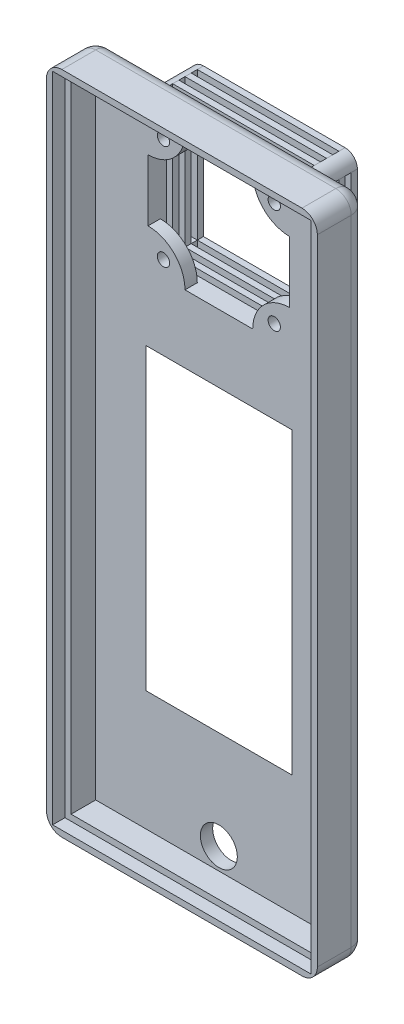
from build123d import *

# Parameters (mm, degrees)
SKICA1_W                 = 23.7
SKICA1_H                 = 48.55
SKICA1_W_2               = 23
SKICA1_H_2               = 22
P_IDAT_VYSUNUT_M1_DEPTH  = 2
SKICA3_R                 = 3
ODEBRAT_VYSUNUT_M1_DEPTH = 4
ZKOSEN_1_SIZE            = 3.464101615
ZKOSEN_1_SIZE_2          = 2
SKICA5_W                 = 44
SKICA5_H                 = 108
SKICA5_W_2               = 40
SKICA5_H_2               = 104
P_IDAT_VYSUNUT_M3_DEPTH  = 6
ZAOBLIT2_R               = 2.5
SKICA6_W                 = 27
SKICA6_H                 = 26
SKICA6_W_2               = 23
SKICA6_H_2               = 22
P_IDAT_VYSUNUT_M4_DEPTH  = 7
SKICA7_R                 = 1
P_IDAT_VYSUNUT_M5_DEPTH  = 2
SKICA8_W                 = 23
SKICA8_H                 = 1
ODEBRAT_VYSUNUT_M3_DEPTH = 30
SKICA9_W                 = 1
SKICA9_H                 = 22
ODEBRAT_VYSUNUT_M4_DEPTH = 30
ZAOBLIT3_R               = 2
SKICA10_W                = 42
SKICA10_H                = 106
SKICA10_W_2              = 40
SKICA10_H_2              = 104
ODEBRAT_VYSUNUT_M5_DEPTH = 2


# Some blends are built 0.0001 mm under size
with BuildPart() as part:
    # Skica1 → Přidat vysunutím1 (new body)
    with BuildSketch(Plane.XY):
        Polygon((-10.15, 2), (-10.15, 25), (33.85, 25), (33.85, 2), (33.85, -83), (-10.15, -83), (-10.15, -61.55), align=None)
        with Locations((11.85, -37.275)):
            Rectangle(SKICA1_W, SKICA1_H, mode=Mode.SUBTRACT)
        with Locations((11.85, 9)):
            Rectangle(SKICA1_W_2, SKICA1_H_2, mode=Mode.SUBTRACT)
    extrude(amount=P_IDAT_VYSUNUT_M1_DEPTH)

    # Skica3 → Odebrat vysunutím1 (cut)
    with BuildSketch(Plane.XY.offset(2)):
        with Locations((11.85, -77.5)):
            Circle(SKICA3_R)
    extrude(amount=-ODEBRAT_VYSUNUT_M1_DEPTH, mode=Mode.SUBTRACT)

    # Zkosení1
    # the kernel refuses this chamfer: 3.464101615, 2 mm, written as the material it takes off along each edge
    with BuildSketch(Plane(origin=(0, -13, 0), x_dir=(-0.9998132206222079, 0, -0.019326765612700626), z_dir=(0, -1, 0)), Plane(origin=(23.7, -61.55, 0), x_dir=(0.9998132206222079, 0, -0.019326765612700608), z_dir=(0, 1, 0))) as zkosen_1_piece_1:
        Polygon((ZKOSEN_1_SIZE * 0.999813220662, -ZKOSEN_1_SIZE * 0.0193267656135), (-ZKOSEN_1_SIZE_2 * 0.0193267656127, -ZKOSEN_1_SIZE_2 * 0.999813220622), (0, 0), align=None)
    extrude(amount=48.55, mode=Mode.SUBTRACT)
    with BuildSketch(Plane(origin=(0, -61.55, 0), x_dir=(0, -0.9998132206222079, -0.01932676561270056), z_dir=(1, 0, 0)), Plane(origin=(23.7, -13, 0), x_dir=(0, 0.9998132206222079, -0.019326765612700643), z_dir=(-1, 0, 0))) as zkosen_1_piece_2:
        Polygon((ZKOSEN_1_SIZE * 0.999813220662, -ZKOSEN_1_SIZE * 0.0193267656135), (-ZKOSEN_1_SIZE_2 * 0.0193267656127, -ZKOSEN_1_SIZE_2 * 0.999813220622), (0, 0), align=None)
    extrude(amount=23.7, mode=Mode.SUBTRACT)
    with BuildSketch(Plane(origin=(0, -4.038072059, 0), x_dir=(-0.9998132206222079, 0, -0.019326765612700622), z_dir=(0, -1, 0))) as zkosen_1_piece_3a_section:
        Polygon((ZKOSEN_1_SIZE * 0.999813220662, -ZKOSEN_1_SIZE * 0.0193267656135), (-ZKOSEN_1_SIZE_2 * 0.0193267656127, -ZKOSEN_1_SIZE_2 * 0.999813220622), (0, 0), align=None)
    zkosen_1_piece_3a = extrude(amount=57.511927941, mode=Mode.PRIVATE)
    zkosen_1_piece_3a = split(zkosen_1_piece_3a, bisect_by=Plane(origin=(-1.161798269, -13, 0.64133979), z_dir=(0, 1, 0)), keep=Keep.TOP, mode=Mode.PRIVATE)
    with BuildSketch(Plane(origin=(23.7, -13, 0), x_dir=(0, 0.9998132206222079, -0.019326765612700643), z_dir=(-1, 0, 0))) as zkosen_1_piece_3b_section:
        Polygon((ZKOSEN_1_SIZE * 0.999813220662, -ZKOSEN_1_SIZE * 0.0193267656135), (-ZKOSEN_1_SIZE_2 * 0.0193267656127, -ZKOSEN_1_SIZE_2 * 0.999813220622), (0, 0), align=None)
    zkosen_1_piece_3b = extrude(amount=32.661927941, mode=Mode.PRIVATE)
    zkosen_1_piece_3b = split(zkosen_1_piece_3b, bisect_by=Plane(origin=(0, -11.838201731, 0.64133979), z_dir=(-1, 0, 0)), keep=Keep.TOP, mode=Mode.PRIVATE)
    zkosen_1_piece_3 = zkosen_1_piece_3a & zkosen_1_piece_3b
    add(zkosen_1_piece_3, mode=Mode.SUBTRACT)
    with BuildSketch(Plane(origin=(0, -13, 0), x_dir=(-0.9998132206222079, 0, -0.019326765612700626), z_dir=(0, -1, 0))) as zkosen_1_piece_4a_section:
        Polygon((ZKOSEN_1_SIZE * 0.999813220662, -ZKOSEN_1_SIZE * 0.0193267656135), (-ZKOSEN_1_SIZE_2 * 0.0193267656127, -ZKOSEN_1_SIZE_2 * 0.999813220622), (0, 0), align=None)
    zkosen_1_piece_4a = extrude(amount=57.511927941, mode=Mode.PRIVATE)
    zkosen_1_piece_4a = split(zkosen_1_piece_4a, bisect_by=Plane(origin=(-1.161798269, -61.55, 0.64133979), z_dir=(0, -1, 0)), keep=Keep.TOP, mode=Mode.PRIVATE)
    with BuildSketch(Plane(origin=(-8.961927941, -61.55, 0), x_dir=(0, -0.9998132206222079, -0.01932676561270056), z_dir=(1, 0, 0))) as zkosen_1_piece_4b_section:
        Polygon((ZKOSEN_1_SIZE * 0.999813220662, -ZKOSEN_1_SIZE * 0.0193267656135), (-ZKOSEN_1_SIZE_2 * 0.0193267656127, -ZKOSEN_1_SIZE_2 * 0.999813220622), (0, 0), align=None)
    zkosen_1_piece_4b = extrude(amount=32.661927941, mode=Mode.PRIVATE)
    zkosen_1_piece_4b = split(zkosen_1_piece_4b, bisect_by=Plane(origin=(0, -62.711798269, 0.64133979), z_dir=(-1, 0, 0)), keep=Keep.TOP, mode=Mode.PRIVATE)
    zkosen_1_piece_4 = zkosen_1_piece_4a & zkosen_1_piece_4b
    add(zkosen_1_piece_4, mode=Mode.SUBTRACT)
    with BuildSketch(Plane(origin=(0, -61.55, 0), x_dir=(0, -0.9998132206222079, -0.01932676561270056), z_dir=(1, 0, 0))) as zkosen_1_piece_5a_section:
        Polygon((ZKOSEN_1_SIZE * 0.999813220662, -ZKOSEN_1_SIZE * 0.0193267656135), (-ZKOSEN_1_SIZE_2 * 0.0193267656127, -ZKOSEN_1_SIZE_2 * 0.999813220622), (0, 0), align=None)
    zkosen_1_piece_5a = extrude(amount=32.661927941, mode=Mode.PRIVATE)
    zkosen_1_piece_5a = split(zkosen_1_piece_5a, bisect_by=Plane(origin=(23.7, -62.711798269, 0.64133979), z_dir=(1, 0, 0)), keep=Keep.TOP, mode=Mode.PRIVATE)
    with BuildSketch(Plane(origin=(23.7, -70.511927941, 0), x_dir=(0.9998132206222079, 0, -0.019326765612700608), z_dir=(0, 1, 0))) as zkosen_1_piece_5b_section:
        Polygon((ZKOSEN_1_SIZE * 0.999813220662, -ZKOSEN_1_SIZE * 0.0193267656135), (-ZKOSEN_1_SIZE_2 * 0.0193267656127, -ZKOSEN_1_SIZE_2 * 0.999813220622), (0, 0), align=None)
    zkosen_1_piece_5b = extrude(amount=57.511927941, mode=Mode.PRIVATE)
    zkosen_1_piece_5b = split(zkosen_1_piece_5b, bisect_by=Plane(origin=(24.861798269, -61.55, 0.64133979), z_dir=(0, -1, 0)), keep=Keep.TOP, mode=Mode.PRIVATE)
    zkosen_1_piece_5 = zkosen_1_piece_5a & zkosen_1_piece_5b
    add(zkosen_1_piece_5, mode=Mode.SUBTRACT)
    with BuildSketch(Plane(origin=(32.661927941, -13, 0), x_dir=(0, 0.9998132206222079, -0.019326765612700643), z_dir=(-1, 0, 0))) as zkosen_1_piece_6a_section:
        Polygon((ZKOSEN_1_SIZE * 0.999813220662, -ZKOSEN_1_SIZE * 0.0193267656135), (-ZKOSEN_1_SIZE_2 * 0.0193267656127, -ZKOSEN_1_SIZE_2 * 0.999813220622), (0, 0), align=None)
    zkosen_1_piece_6a = extrude(amount=32.661927941, mode=Mode.PRIVATE)
    zkosen_1_piece_6a = split(zkosen_1_piece_6a, bisect_by=Plane(origin=(23.7, -11.838201731, 0.64133979), z_dir=(1, 0, 0)), keep=Keep.TOP, mode=Mode.PRIVATE)
    with BuildSketch(Plane(origin=(23.7, -61.55, 0), x_dir=(0.9998132206222079, 0, -0.019326765612700608), z_dir=(0, 1, 0))) as zkosen_1_piece_6b_section:
        Polygon((ZKOSEN_1_SIZE * 0.999813220662, -ZKOSEN_1_SIZE * 0.0193267656135), (-ZKOSEN_1_SIZE_2 * 0.0193267656127, -ZKOSEN_1_SIZE_2 * 0.999813220622), (0, 0), align=None)
    zkosen_1_piece_6b = extrude(amount=57.511927941, mode=Mode.PRIVATE)
    zkosen_1_piece_6b = split(zkosen_1_piece_6b, bisect_by=Plane(origin=(24.861798269, -13, 0.64133979), z_dir=(0, 1, 0)), keep=Keep.TOP, mode=Mode.PRIVATE)
    zkosen_1_piece_6 = zkosen_1_piece_6a & zkosen_1_piece_6b
    add(zkosen_1_piece_6, mode=Mode.SUBTRACT)

    # Skica5 → Přidat vysunutím3 (add)
    with BuildSketch(Plane.XY.offset(2)):
        with Locations((11.85, -29)):
            Rectangle(SKICA5_W, SKICA5_H)
        with Locations((11.85, -29)):
            Rectangle(SKICA5_W_2, SKICA5_H_2, mode=Mode.SUBTRACT)
    extrude(amount=P_IDAT_VYSUNUT_M3_DEPTH)

    # Zaoblit2
    zaoblit2_edges = [part.edges().sort_by_distance(p)[0] for p in [
        (33.85, -83, 4),
        (-10.15, -83, 4),
        (-10.15, 25, 4),
        (33.85, 25, 4),
        (33.85, -29, 0),
        (11.85, -83, 0),
        (-10.15, -29, 0),
        (11.85, 25, 0),
    ]]
    fillet(zaoblit2_edges, radius=ZAOBLIT2_R - 0.0001)  # a hair under: the kernel refuses the full size

    # Skica6 → Přidat vysunutím4 (add)
    with BuildSketch(Plane(origin=(0, 0, 0), x_dir=(-1, 0, 0), z_dir=(0, 0, -1))):
        with Locations((-11.85, 9)):
            Rectangle(SKICA6_W, SKICA6_H)
        with Locations((-11.85, 9)):
            Rectangle(SKICA6_W_2, SKICA6_H_2, mode=Mode.SUBTRACT)
    extrude(amount=P_IDAT_VYSUNUT_M4_DEPTH)

    # Skica7 → Přidat vysunutím5 (add)
    # profile 1 of 4: a face of its own
    with BuildSketch(Plane(origin=(0, 0, 0), x_dir=(-1, 0, 0), z_dir=(0, 0, -1))):
        with BuildLine():
            Line((-23.35, -2), (-23.35, 4))
            ThreePointArc((-23.35, 4), (-19.107359313, 2.242640687), (-17.35, -2))
            Line((-17.35, -2), (-23.35, -2))
        make_face()
        with Locations((-20.85, 0.5)):
            Circle(SKICA7_R, mode=Mode.SUBTRACT)
    # profile 2 of 4: a face of its own
    with BuildSketch(Plane(origin=(0, 0, 0), x_dir=(-1, 0, 0), z_dir=(0, 0, -1))):
        with BuildLine():
            Line((-0.35, 20), (-6.35, 20))
            ThreePointArc((-6.35, 20), (-4.592640687, 15.757359313), (-0.35, 14))
            Line((-0.35, 14), (-0.35, 20))
        make_face()
        with Locations((-2.85, 17.5)):
            Circle(SKICA7_R, mode=Mode.SUBTRACT)
    # profile 3 of 4: a face of its own
    with BuildSketch(Plane(origin=(0, 0, 0), x_dir=(-1, 0, 0), z_dir=(0, 0, -1))):
        with BuildLine():
            Line((-0.35, -2), (-0.35, 4))
            ThreePointArc((-0.35, 4), (-4.592640687, 2.242640687), (-6.35, -2))
            Line((-6.35, -2), (-0.35, -2))
        make_face()
        with Locations((-2.85, 0.5)):
            Circle(SKICA7_R, mode=Mode.SUBTRACT)
    # profile 4 of 4: a face of its own
    with BuildSketch(Plane(origin=(0, 0, 0), x_dir=(-1, 0, 0), z_dir=(0, 0, -1))):
        with BuildLine():
            Line((-23.35, 20), (-23.35, 14))
            ThreePointArc((-23.35, 14), (-19.107359313, 15.757359313), (-17.35, 20))
            Line((-17.35, 20), (-23.35, 20))
        make_face()
        with Locations((-20.85, 17.5)):
            Circle(SKICA7_R, mode=Mode.SUBTRACT)
    extrude(amount=-P_IDAT_VYSUNUT_M5_DEPTH)

    # Skica8 → Odebrat vysunutím3 (cut)
    with BuildSketch(Plane.XZ.offset(4)):
        with Locations((11.85, -5.5)):
            Rectangle(SKICA8_W, SKICA8_H)
        with Locations((11.85, -3.5)):
            Rectangle(SKICA8_W, SKICA8_H)
        with Locations((11.85, -1.5)):
            Rectangle(SKICA8_W, SKICA8_H)
    extrude(amount=-ODEBRAT_VYSUNUT_M3_DEPTH, mode=Mode.SUBTRACT)

    # Skica9 → Odebrat vysunutím4 (cut)
    with BuildSketch(Plane.ZY.offset(1.65)):
        with Locations((-5.5, 9)):
            Rectangle(SKICA9_W, SKICA9_H)
        with Locations((-3.5, 9)):
            Rectangle(SKICA9_W, SKICA9_H)
        with Locations((-1.5, 9)):
            Rectangle(SKICA9_W, SKICA9_H)
    extrude(amount=-ODEBRAT_VYSUNUT_M4_DEPTH, mode=Mode.SUBTRACT)

    # Zaoblit3
    zaoblit3_edges = [part.edges().sort_by_distance(p)[0] for p in [
        (-1.65, -4, -3.5),
        (-1.65, 22, -3.5),
        (25.35, 22, -3.5),
        (25.35, -4, -3.5),
    ]]
    fillet(zaoblit3_edges, radius=ZAOBLIT3_R - 0.0001)  # a hair under: the kernel refuses the full size

    # Skica10 → Odebrat vysunutím5 (cut)
    with BuildSketch(Plane.XY.offset(8)):
        with Locations((11.85, -29)):
            Rectangle(SKICA10_W, SKICA10_H)
        with Locations((11.85, -29)):
            Rectangle(SKICA10_W_2, SKICA10_H_2, mode=Mode.SUBTRACT)
    extrude(amount=-ODEBRAT_VYSUNUT_M5_DEPTH, mode=Mode.SUBTRACT)


solid = part.part
